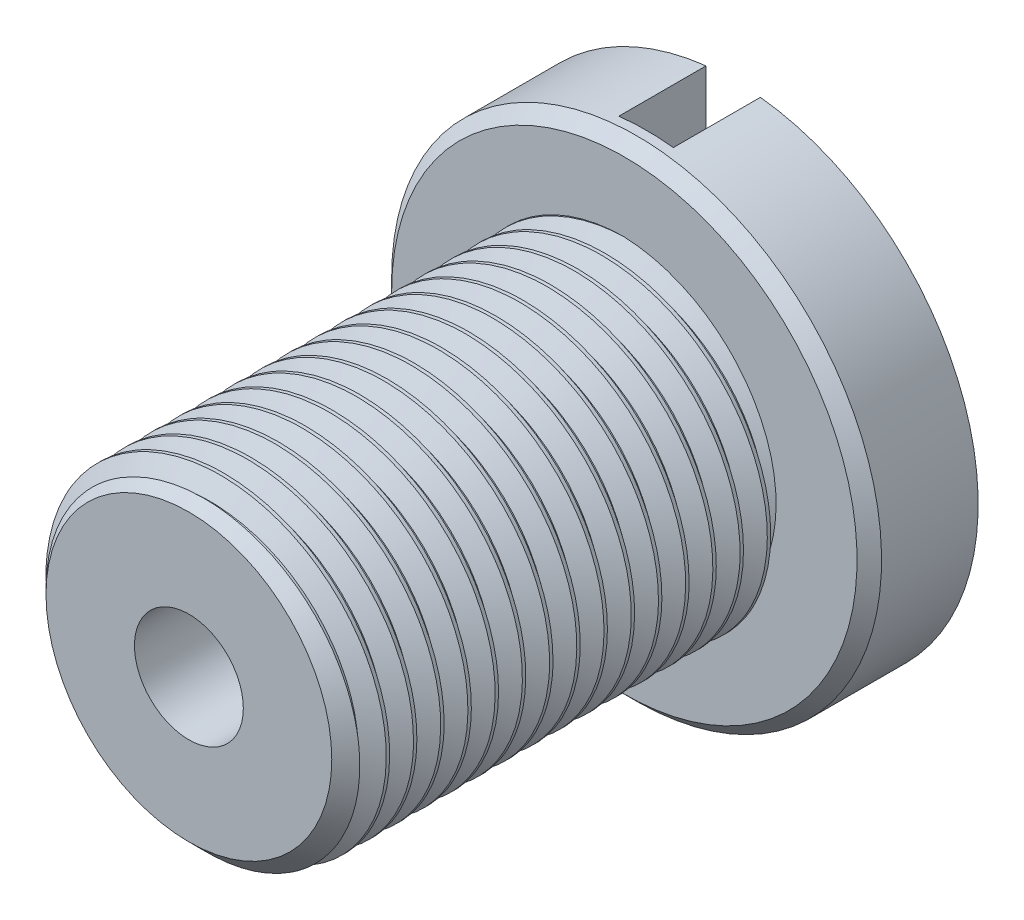
from build123d import *

# Parameters (mm, degrees)
SKETCH1_R          = 9.525
EXTRUDE1_DEPTH     = 25.4
CHAMFER3_SIZE      = 1.190625
CUT_SWEEP1_PITCH   = 1.5875
SKETCH6_R          = 14.2875
EXTRUDE2_DEPTH     = 19.05
CUT_EXTRUDE1_DEPTH = 11.90625
CHAMFER1_SIZE      = 1.42875
CHAMFER2_SIZE      = 0.714375
SKETCH11_R         = 17.347326212
CUT_EXTRUDE4_DEPTH = 12.7
SKETCH13_R         = 3.175
CUT_EXTRUDE6_DEPTH = 38.634131036
SKETCH15_W         = 3.175
SKETCH15_H         = 30.48
CUT_EXTRUDE7_DEPTH = 5.08


with BuildPart() as part:
    # Sketch1 → Extrude1 (new body)
    with BuildSketch(Plane.XY):
        Circle(SKETCH1_R)
    extrude(amount=-EXTRUDE1_DEPTH)

    # Chamfer3
    chamfer3_edges = [part.edges().sort_by_distance(p)[0] for p in [
        (-9.525, 0, 0),
    ]]
    chamfer(chamfer3_edges, length=CHAMFER3_SIZE)

    # Cut-Sweep1: the profile of Sketch3 profile screwed along a right-hand helix of 17 turns, 6 arcs to a turn; built about Z, then put on its axis
    cut_sweep1_z = Axis((0, 0, 0), (0, 0, 1))
    cut_sweep1_corners = [(9.5253, 0, -1.389235705), (8.493888504, 0, -0.79375), (8.493888504, 0, -0.5953125), (9.5253, 0, 0.000173205)]
    with BuildLine(mode=Mode.PRIVATE) as cut_sweep1_profile:
        Line(cut_sweep1_corners[0], cut_sweep1_corners[1])
        Line(cut_sweep1_corners[1], cut_sweep1_corners[2])
        Line(cut_sweep1_corners[2], cut_sweep1_corners[3])
        Line(cut_sweep1_corners[3], cut_sweep1_corners[0])
    cut_sweep1_cap = Face(cut_sweep1_profile.wire())
    cut_sweep1_turn_angles = [0, 30, 60, 90, 120, 150, 180, 210, 240, 270, 300, 330, 360]
    cut_sweep1_turn_weights = [1, 0.8660254037844387, 1, 0.8660254037844387, 1, 0.8660254037844387, 1, 0.8660254037844387, 1, 0.8660254037844387, 1, 0.8660254037844387, 1]
    cut_sweep1_turn_rails = [Edge.make_bspline([Vector(p[0], p[1], 0).rotate(cut_sweep1_z, cut_sweep1_turn_angles[k]) / cut_sweep1_turn_weights[k] + Vector(0, 0, p[2] + CUT_SWEEP1_PITCH * cut_sweep1_turn_angles[k] / 360) for k in range(13)], [0, 0, 0, 1, 1, 2, 2, 3, 3, 4, 4, 5, 5, 6, 6, 6], 2, cut_sweep1_turn_weights) for p in cut_sweep1_corners]
    cut_sweep1_turn_sides = [Face.make_surface_from_curves(cut_sweep1_turn_rails[p[0]], cut_sweep1_turn_rails[p[1]]) for p in [(0, 1), (1, 2), (2, 3), (3, 0)]]
    cut_sweep1 = Plane(origin=(0, 0, 0), x_dir=(0, 1, 0), z_dir=(0, 0, -1)) * Solid(Shell([*[p.moved(Location((0, 0, CUT_SWEEP1_PITCH * i))) for i in range(17) for p in cut_sweep1_turn_sides], cut_sweep1_cap, cut_sweep1_cap.rotate(cut_sweep1_z, 6120).moved(Location((0, 0, CUT_SWEEP1_PITCH * 6120 / 360)))]))
    add(cut_sweep1, mode=Mode.SUBTRACT)

    # Sketch6 → Extrude2 (add)
    with BuildSketch(Plane(origin=(0, 0, -25.4), x_dir=(-1, 0, 0), z_dir=(0, 0, -1))):
        with Locations(Location((0, 0, 0), (0, 0, 180))):
            Circle(SKETCH6_R)
    extrude(amount=EXTRUDE2_DEPTH)

    # Sketch7 → Cut-Extrude1 (cut)
    with BuildSketch(Plane(origin=(0, 0, -44.45), x_dir=(-1, 0, 0), z_dir=(0, 0, -1))):
        Polygon((0, 9.165435523), (-7.9375, 4.582717762), (-7.9375, -4.582717762), (0, -9.165435523), (7.9375, -4.582717762), (7.9375, 4.582717762), align=None)
    extrude(amount=-CUT_EXTRUDE1_DEPTH, mode=Mode.SUBTRACT)

    # Cut-Extrude2 cone 1 section (through the dimple's axis) → Cut-Extrude2 (revolve, cut)
    with BuildSketch(Plane(origin=(0, 0, -44.45), x_dir=(0, 1, 0), z_dir=(1, 0, 0))):
        Polygon((0, 0), (9.165435523, 0), (0, 9.165435523), align=None)
    revolve(axis=Axis((0, 0, -44.45), (0, 0, 1)), mode=Mode.SUBTRACT)

    # Chamfer1
    chamfer1_edges = [part.edges().sort_by_distance(p)[0] for p in [
        (-14.2875, 0, -44.45),
    ]]
    chamfer(chamfer1_edges, length=CHAMFER1_SIZE)

    # Chamfer2
    chamfer2_edges = [part.edges().sort_by_distance(p)[0] for p in [
        (-14.2875, 0, -25.4),
    ]]
    chamfer(chamfer2_edges, length=CHAMFER2_SIZE)

    # Sketch11 → Cut-Extrude4 (cut)
    with BuildSketch(Plane(origin=(0, 0, -44.45), x_dir=(-1, 0, 0), z_dir=(0, 0, -1))):
        Circle(SKETCH11_R)
    extrude(amount=-CUT_EXTRUDE4_DEPTH, mode=Mode.SUBTRACT)

    # Sketch13 → Cut-Extrude6 (cut, through all)
    with BuildSketch(Plane(origin=(0, 0, -31.75), x_dir=(-1, 0, 0), z_dir=(0, 0, -1))):
        Circle(SKETCH13_R)
    extrude(amount=-CUT_EXTRUDE6_DEPTH, mode=Mode.SUBTRACT)

    # Sketch15 → Cut-Extrude7 (cut)
    with BuildSketch(Plane(origin=(0, 0, -31.75), x_dir=(-1, 0, 0), z_dir=(0, 0, -1))):
        Rectangle(SKETCH15_W, SKETCH15_H)
    extrude(amount=-CUT_EXTRUDE7_DEPTH, mode=Mode.SUBTRACT)


solid = part.part
